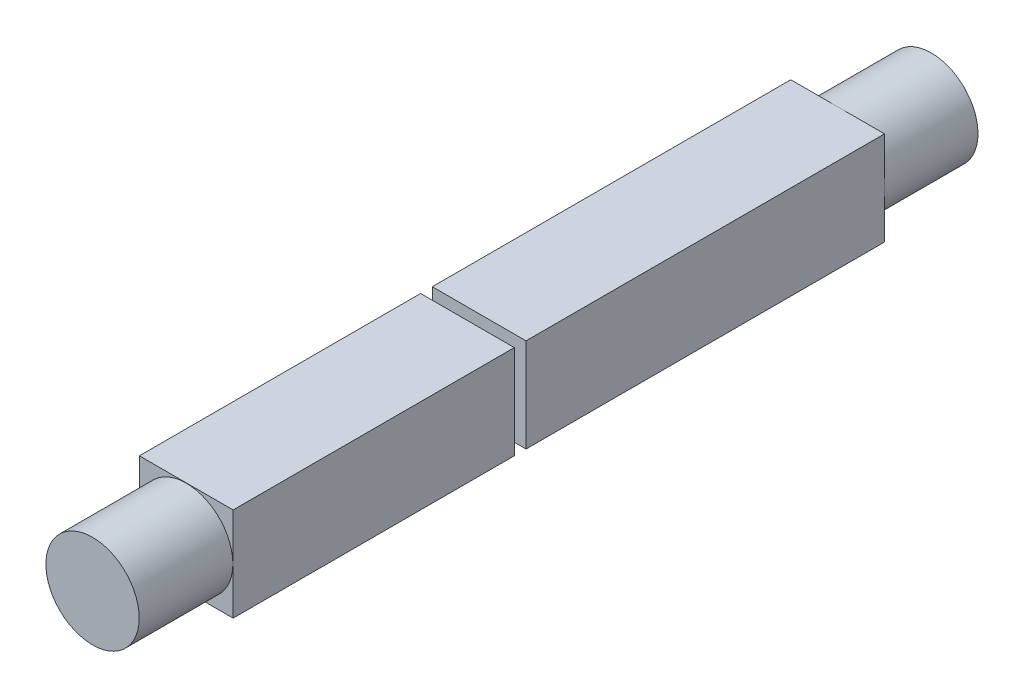
from build123d import *

# Parameters (mm, degrees)
SKETCH1_W           = 4
SKETCH1_H           = 4
BOSS_EXTRUDE1_DEPTH = 13.9
SKETCH2_R           = 1.99
BOSS_EXTRUDE2_DEPTH = 4
CUT_EXTRUDE1_REACH  = 20.45
SKETCH3_W           = 4
SKETCH3_H           = 0.5


with BuildPart() as part:
    # Sketch1 → Boss-Extrude1 (new, symmetric)
    with BuildSketch(Plane.XY):
        Rectangle(SKETCH1_W, SKETCH1_H)
    extrude(amount=BOSS_EXTRUDE1_DEPTH, both=True)

    # Sketch2 → Boss-Extrude2 (add)
    with BuildSketch(Plane.XY.offset(13.9)):
        Circle(SKETCH2_R)
    boss_extrude2 = extrude(amount=BOSS_EXTRUDE2_DEPTH)

    # Mirror2: Boss-Extrude2 across plane
    add(boss_extrude2.mirror(Plane.XY))

    # Sketch3 → Cut-Extrude1 (cut, up to next)
    with BuildSketch(Plane(origin=(0, 2, 0), x_dir=(1, 0, 0), z_dir=(0, 1, 0)), mode=Mode.PRIVATE) as cut_extrude1_sk1:
        with Locations((0, -1.65)):
            Rectangle(SKETCH3_W, SKETCH3_H)
    cut_extrude1_tool1 = extrude(cut_extrude1_sk1.sketch, amount=-CUT_EXTRUDE1_REACH, mode=Mode.PRIVATE) & part.part
    add(cut_extrude1_tool1.solids().sort_by_distance((0, 2, 1.65))[0], mode=Mode.SUBTRACT)


with BuildPart() as cut_extrude1_piece_1:
    # of the separate pieces the step leaves, piece 1, a body of its own (cut_extrude1_pieces)
    add(part.part.solids().sort_by_distance((2, -2, -13.9))[0])


with BuildPart() as cut_extrude1_piece_2:
    # of the separate pieces the step leaves, piece 2, a body of its own (cut_extrude1_pieces)
    add(part.part.solids().sort_by_distance((2, -2, 1.9))[0])


solid = Compound([cut_extrude1_piece_1.part, cut_extrude1_piece_2.part])
